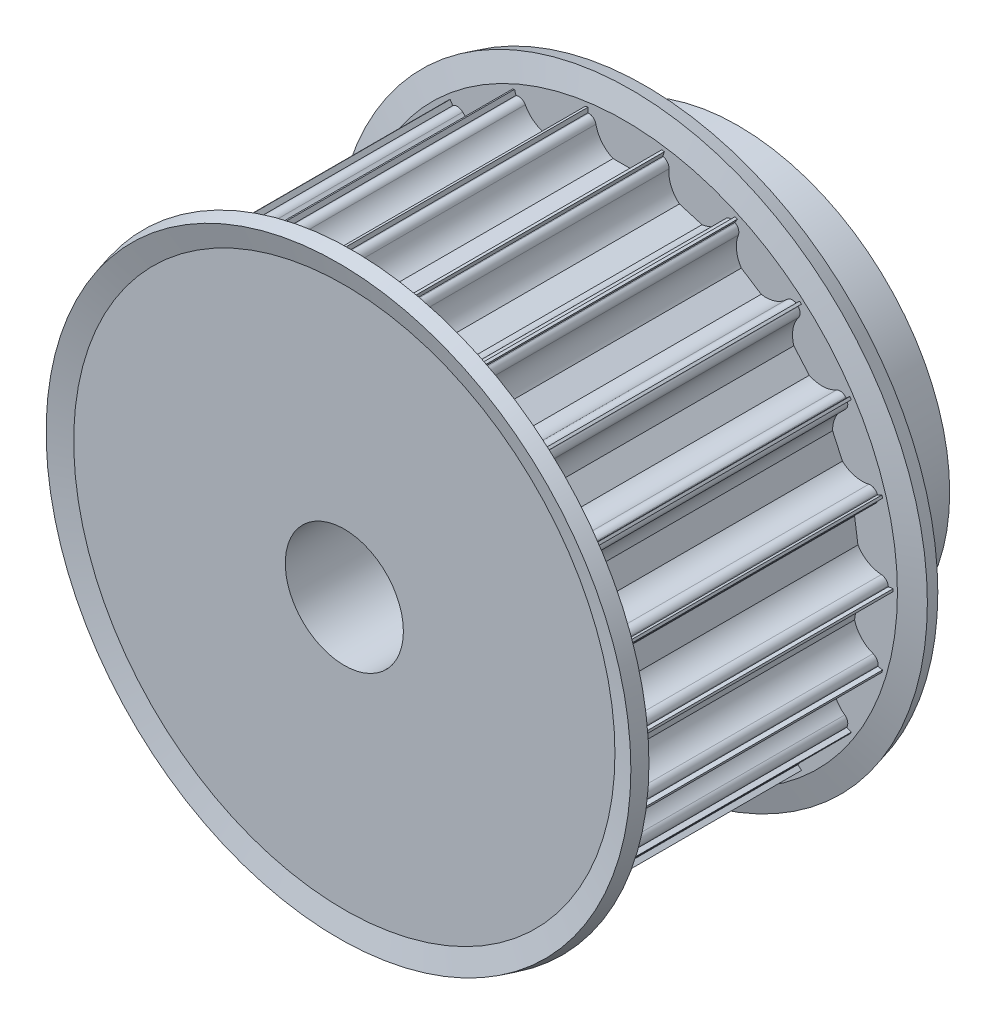
from build123d import *

# Parameters (mm, degrees)
CUT_EXTRUDE1_DEPTH = 56.543901555
CIRPATTERN1_COUNT  = 22


with BuildPart() as part:
    # Sketch1 → Revolve1 (revolve)
    with BuildSketch(Plane(origin=(0, 0, 0), x_dir=(0, 0, -1), z_dir=(1, 0, 0))):
        Polygon((0, 6), (0, 27.25), (30, 27.25), (30, 21.5), (40, 21.5), (40, 6), align=None)
    revolve(axis=Axis((0, 0, 29.536098978), (0, 0, -1)))

    # Sketch2 → Cut-Extrude1 (cut, through all)
    with BuildSketch(Plane.XY):
        with BuildLine():
            Line((3.674234614, 26.5), (3.75, 26.5))
            Line((3.75, 26.5), (3.75, 28.5))
            Line((3.75, 28.5), (-3.75, 28.5))
            Line((-3.75, 28.5), (-3.75, 26.5))
            Line((-3.75, 26.5), (-3.674234614, 26.5))
            ThreePointArc((-3.674234614, 26.5), (-3.199892965, 26.330947502), (-2.939387691, 25.9))
            ThreePointArc((-2.939387691, 25.9), (-2.331759211, 24.612435701), (-1.198957881, 23.75))
            Line((-1.198957881, 23.75), (1.198957881, 23.75))
            ThreePointArc((1.198957881, 23.75), (2.331759211, 24.612435701), (2.939387691, 25.9))
            ThreePointArc((2.939387691, 25.9), (3.199892965, 26.330947502), (3.674234614, 26.5))
        make_face()
    cut_extrude1 = extrude(amount=-CUT_EXTRUDE1_DEPTH, mode=Mode.SUBTRACT)

    # CirPattern1: Cut-Extrude1 ×22 about axis
    cirpattern1_axis = Axis((0, 0, 21.209859057), (0, 0, -1))
    for i in range(1, CIRPATTERN1_COUNT):
        add(cut_extrude1.rotate(cirpattern1_axis, i * 360 / CIRPATTERN1_COUNT), mode=Mode.SUBTRACT)

    # Sketch4 → Revolve2 (revolve)
    with BuildSketch(Plane(origin=(0, 0, 0), x_dir=(0, 0, -1), z_dir=(1, 0, 0))):
        Polygon((-0.591966801, 29.702510585), (0, 27.493260406), (0, 22.690739153), (1.5, 22.690739153), (1.5, 27.690739153), (0.856921938, 30.090739153), align=None)
        Polygon((30.591966801, 29.702510585), (29.143078062, 30.090739153), (28.5, 27.690739153), (28.5, 22.690739153), (30, 22.690739153), (30, 27.493260406), align=None)
    revolve(axis=Axis((0, 0, 21.209859057), (0, 0, -1)))


solid = part.part
